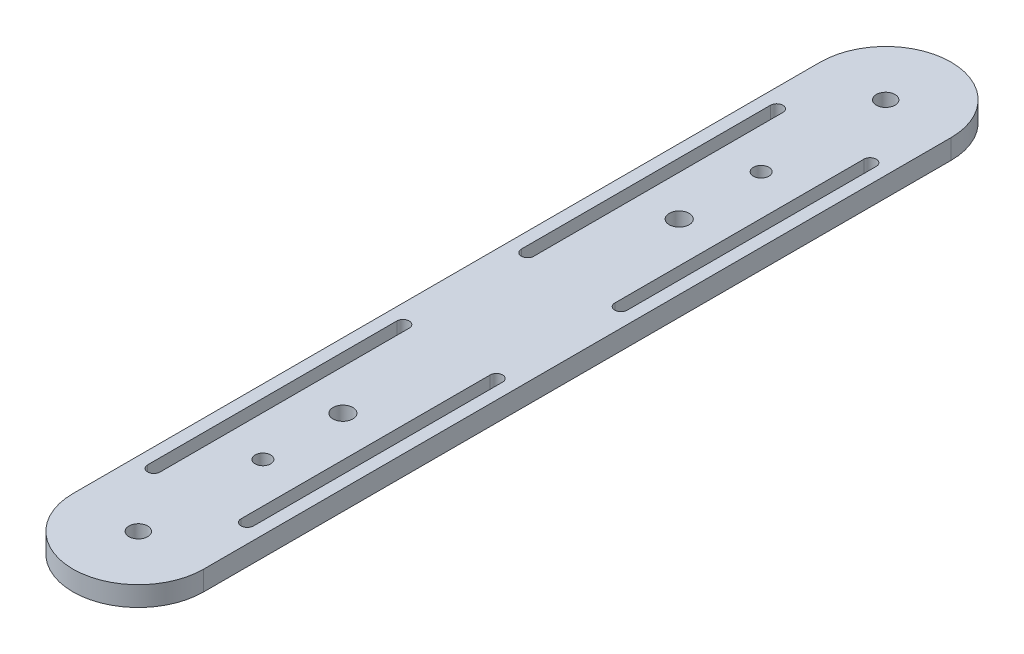
from build123d import *

# Parameters (mm, degrees)
SKETCH1_R               = 1.5
BOSS_EXTRUDE1_DEPTH     = 3.175
CUT_EXTRUDE1_DEPTH      = 131.960225355
CUT_EXTRUDE1_DEPTH_BACK = 131.960225355
CUT_EXTRUDE2_DEPTH      = 131.960225355
CUT_EXTRUDE2_DEPTH_BACK = 131.960225355
CUT_EXTRUDE3_DEPTH      = 131.960225355
CUT_EXTRUDE3_DEPTH_BACK = 131.960225355
SKETCH4_R               = 1.6
CUT_EXTRUDE4_DEPTH      = 40


with BuildPart() as part:
    # Sketch1 → Boss-Extrude1 (new body)
    with BuildSketch(Plane(origin=(0, 0, 0), x_dir=(1, 0, 0), z_dir=(0, 1, 0))):
        with BuildLine():
            Line((-10.5, 0), (-10.5, -120))
            ThreePointArc((-10.5, -120), (0, -130.5), (10.5, -120))
            Line((10.5, -120), (10.5, 0))
            ThreePointArc((10.5, 0), (0, 10.5), (-10.5, 0))
        make_face()
        Circle(SKETCH1_R, mode=Mode.SUBTRACT)
        with Locations((0, -120)):
            Circle(SKETCH1_R, mode=Mode.SUBTRACT)
    extrude(amount=BOSS_EXTRUDE1_DEPTH)

    # Sketch2 → Cut-Extrude1 (cut, two sides: drawn at the far end of the back side and taken through both)
    with BuildSketch(Plane.XZ.offset(-CUT_EXTRUDE1_DEPTH_BACK)):
        with BuildLine():
            ThreePointArc((0, 18.75), (1.25, 20), (0, 21.25))
            ThreePointArc((0, 21.25), (-1.25, 20), (0, 18.75))
        make_face()
    extrude(amount=CUT_EXTRUDE1_DEPTH + CUT_EXTRUDE1_DEPTH_BACK, mode=Mode.SUBTRACT)

    # Sketch3 → Cut-Extrude2 (cut, two sides: drawn at the far end of the back side and taken through both)
    with BuildSketch(Plane(origin=(0, 3.175, 0), x_dir=(1, 0, 0), z_dir=(0, 1, 0)).offset(-CUT_EXTRUDE2_DEPTH_BACK)):
        with BuildLine():
            ThreePointArc((0, -98.75), (-1.25, -100), (0, -101.25))
            ThreePointArc((0, -101.25), (1.25, -100), (0, -98.75))
        make_face()
    extrude(amount=CUT_EXTRUDE2_DEPTH + CUT_EXTRUDE2_DEPTH_BACK, mode=Mode.SUBTRACT)

    # Sketch4 → Cut-Extrude3 (cut, two sides: drawn at the far end of the back side and taken through both)
    with BuildSketch(Plane(origin=(0, 3.175, 0), x_dir=(1, 0, 0), z_dir=(0, 1, 0)).offset(-CUT_EXTRUDE3_DEPTH_BACK)):
        with Locations((0, -33.15)):
            Circle(SKETCH4_R)
        with Locations((0, -87.15)):
            Circle(SKETCH4_R)
    extrude(amount=CUT_EXTRUDE3_DEPTH + CUT_EXTRUDE3_DEPTH_BACK, mode=Mode.SUBTRACT)

    # Sketch5 → Cut-Extrude4 (cut)
    with BuildSketch(Plane.XZ):
        with BuildLine():
            Line((-8.5, 10), (-8.5, 50))
            ThreePointArc((-8.5, 50), (-7.5, 51), (-6.5, 50))
            Line((-6.5, 50), (-6.5, 10))
            ThreePointArc((-6.5, 10), (-7.5, 9), (-8.5, 10))
        make_face()
        with BuildLine():
            Line((6.5, 50), (6.5, 10))
            ThreePointArc((6.5, 10), (7.5, 9), (8.5, 10))
            Line((8.5, 10), (8.5, 50))
            ThreePointArc((8.5, 50), (7.5, 51), (6.5, 50))
        make_face()
        with BuildLine():
            Line((8.5, 110), (8.5, 70))
            ThreePointArc((8.5, 70), (7.5, 69), (6.5, 70))
            Line((6.5, 70), (6.5, 110))
            ThreePointArc((6.5, 110), (7.5, 111), (8.5, 110))
        make_face()
        with BuildLine():
            Line((-6.5, 70), (-6.5, 110))
            ThreePointArc((-6.5, 110), (-7.5, 111), (-8.5, 110))
            Line((-8.5, 110), (-8.5, 70))
            ThreePointArc((-8.5, 70), (-7.5, 69), (-6.5, 70))
        make_face()
    extrude(amount=-CUT_EXTRUDE4_DEPTH, mode=Mode.SUBTRACT)


solid = part.part
